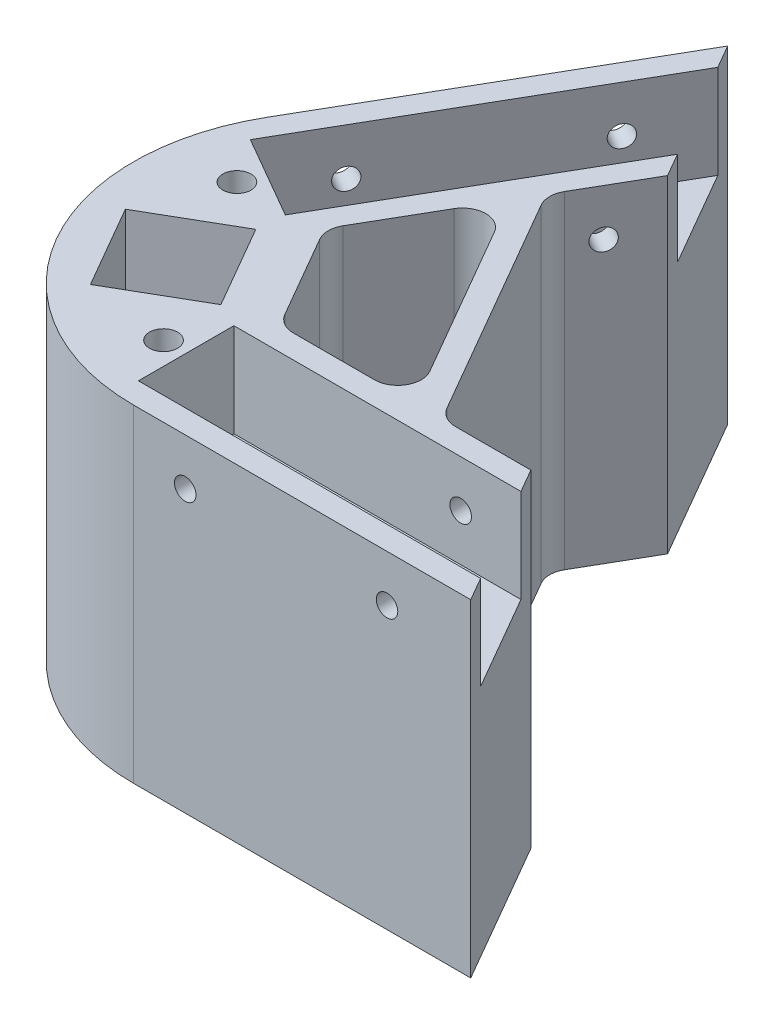
from build123d import *

# Parameters (mm, degrees)
BOSS_EXTRUDE1_DEPTH      = 70
CUT_EXTRUDE2_DEPTH       = 211.416254125
CUT_EXTRUDE2_DEPTH_BACK  = 211.416254125
SKETCH2_W                = 100.4
SKETCH2_H                = 20.4
CUT_EXTRUDE3_DEPTH       = 20
FILLET1_R                = 45
CUT_EXTRUDE4_DEPTH       = 211.416254125
CUT_EXTRUDE4_DEPTH_BACK  = 211.416254125
BOSS_EXTRUDE2_DEPTH      = 70
SKETCH33_R               = 2.3
CUT_EXTRUDE9_DEPTH       = 10
SKETCH34_R               = 2.3
CUT_EXTRUDE10_DEPTH      = 10
FILLET2_R                = 5
CUT_EXTRUDE6_DEPTH       = 5
FILLET3_START            = 72
FILLET3_DEPTH            = 42
FILLET3_START_2          = 73.456949031
FILLET3_2_DEPTH          = 10
FILLET3_START_3          = 108.456949031
FILLET3_3_DEPTH          = 5
SKETCH31_R               = 2.3
CUT_EXTRUDE7_DEPTH       = 10
SKETCH32_R               = 2.3
CUT_EXTRUDE8_DEPTH       = 10
SKETCH35_R               = 2.3
CUT_EXTRUDE11_DEPTH      = 163.520229183
SKETCH36_R               = 4
CUT_EXTRUDE12_DEPTH      = 167.02180224
CUT_EXTRUDE13_DEPTH      = 211.416254158
CUT_EXTRUDE13_DEPTH_BACK = 211.416254158
SKETCH37_R               = 1.7
SKETCH38_R               = 2.3
CUT_EXTRUDE14_DEPTH      = 205.633819321
SKETCH39_R               = 4
CUT_EXTRUDE15_DEPTH      = 46
SKETCH40_R               = 3
CUT_EXTRUDE16_DEPTH      = 210.119583046


with BuildPart() as part:
    # Sketch1 → Boss-Extrude1 (new body)
    with BuildSketch(Plane(origin=(0, 0, 0), x_dir=(1, 0, 0), z_dir=(0, 1, 0))):
        Polygon((0, 0), (150, 0), (75, 129.903810568), align=None)
    extrude(amount=-BOSS_EXTRUDE1_DEPTH)

    # Sketch4 → Cut-Extrude2 (cut, two sides: drawn at the far end of the back side and taken through both)
    with BuildSketch(Plane(origin=(0, 0, 0), x_dir=(1, 0, 0), z_dir=(0, 1, 0)).offset(-CUT_EXTRUDE2_DEPTH_BACK)):
        Polygon((58.511973189, 45.566570047), (40.845863577, 35.365169595), (51.047264029, 17.699059984), (68.713373641, 27.900460435), align=None)
    extrude(amount=CUT_EXTRUDE2_DEPTH + CUT_EXTRUDE2_DEPTH_BACK, mode=Mode.SUBTRACT)

    # Sketch2 → Cut-Extrude3 (cut)
    with BuildSketch(Plane(origin=(0, 0, 0), x_dir=(1, 0, 0), z_dir=(0, 1, 0))):
        Polygon((109.197045256, 138.33483042), (58.997045256, 51.38587988), (41.330127019, 61.58587988), (91.530127019, 148.53483042), align=None)
        with Locations((124.2, 15.2)):
            Rectangle(SKETCH2_W, SKETCH2_H)
    extrude(amount=-CUT_EXTRUDE3_DEPTH, mode=Mode.SUBTRACT)

    # Fillet1
    fillet1_edges = [part.edges().sort_by_distance(p)[0] for p in [
        (0, -35, 0),
    ]]
    fillet(fillet1_edges, radius=FILLET1_R)

    # Sketch27 → Cut-Extrude4 (cut, two sides: drawn at the far end of the back side and taken through both)
    with BuildSketch(Plane(origin=(0, 0, 0), x_dir=(1, 0, 0), z_dir=(0, 1, 0)).offset(-CUT_EXTRUDE4_DEPTH_BACK)):
        Polygon((238.272822489, 351.900634614), (92.551448183, 99.503810568), (65.734741667, 53.05591239), (78.81753352, 30.4), (132.448551817, 30.4), (423.891300428, 30.4), (928.68494852, 321.842748611), (743.066470581, 643.343383225), align=None)
    extrude(amount=CUT_EXTRUDE4_DEPTH + CUT_EXTRUDE4_DEPTH_BACK, mode=Mode.SUBTRACT)

    # Sketch28 → Boss-Extrude2 (add)
    with BuildSketch(Plane(origin=(0, 0, 0), x_dir=(1, 0, 0), z_dir=(0, 1, 0))):
        Polygon((83.054457118, 83.054539524), (113.460135283, 30.4), (107.686368323, 30.4), (80.167837876, 78.054768335), align=None)
    extrude(amount=-BOSS_EXTRUDE2_DEPTH)

    # Sketch33 → Cut-Extrude9 (cut)
    with BuildSketch(Plane(origin=(26.327172275, 0, 15.2), x_dir=(0.4999999999999997, 0, -0.8660254037844388), z_dir=(0.8660254037844389, 0, 0.49999999999999983))):
        with Locations((122.448551817, -10)):
            Circle(SKETCH33_R)
    extrude(amount=-CUT_EXTRUDE9_DEPTH, mode=Mode.SUBTRACT)

    # Sketch34 → Cut-Extrude10 (cut)
    with BuildSketch(Plane(origin=(0, 0, -30.4), x_dir=(-1, 0, 0), z_dir=(0, 0, -1))):
        with Locations((-122.448551817, -10)):
            Circle(SKETCH34_R)
    extrude(amount=-CUT_EXTRUDE10_DEPTH, mode=Mode.SUBTRACT)

    # Fillet2
    fillet2_edges = [part.edges().sort_by_distance(p)[0] for p in [
        (83.054457118, -35, -83.054539524),
        (80.167837876, -35, -78.054768335),
        (65.734741667, -35, -53.05591239),
        (78.81753352, -35, -30.4),
        (107.686368323, -35, -30.4),
        (113.460135283, -35, -30.4),
    ]]
    fillet(fillet2_edges, radius=FILLET2_R)

    # Sketch30 → Cut-Extrude6 (cut)
    with BuildSketch(Plane.XZ.offset(70)):
        Polygon((62.116998953, -39.323625207), (122.736002524, -74.32843068), (125.736414421, -69.132516088), (65.117410851, -34.127710616), align=None)
    extrude(amount=-CUT_EXTRUDE6_DEPTH, mode=Mode.SUBTRACT)

    # Fillet3: read off the stored shape, not the designer's step
    # Fillet3 outline → Fillet3 (cut)
    with BuildSketch(Plane(origin=(0, 0, 0), x_dir=(0.5000686496051991, 0, 0.8659857652883406), z_dir=(0.8659857652883404, 0, -0.5000686496051993)).offset(FILLET3_START)):
        with BuildLine():
            Line((-2.990935885, 70), (-5.490935885, 70))
            ThreePointArc((-5.490935885, 70), (-3.723168932, 69.267766953), (-2.990935885, 67.5))
            Line((-2.990935885, 67.5), (-2.990935885, 70))
        make_face()
        with BuildLine():
            Line((5.509064115, 70), (3.009064115, 70))
            Line((3.009064115, 70), (3.009064115, 67.5))
            ThreePointArc((3.009064115, 67.5), (3.741297162, 69.267766953), (5.509064115, 70))
        make_face()
    extrude(amount=FILLET3_DEPTH, mode=Mode.SUBTRACT)

    # Fillet3 2 outline → Fillet3 2 (add)
    with BuildSketch(Plane(origin=(0, 0, 0), x_dir=(0.5000686496051991, 0, 0.8659857652883406), z_dir=(0.8659857652883404, 0, -0.5000686496051993)).offset(FILLET3_START_2)):
        with BuildLine():
            ThreePointArc((-0.490935885, 65), (-2.258702838, 65.732233047), (-2.990935885, 67.5))
            Line((-2.990935885, 67.5), (-2.990935885, 65))
            Line((-2.990935885, 65), (-0.490935885, 65))
        make_face()
        with BuildLine():
            ThreePointArc((3.009064115, 67.5), (2.276831068, 65.732233047), (0.509064115, 65))
            Line((0.509064115, 65), (3.009064115, 65))
            Line((3.009064115, 65), (3.009064115, 67.5))
        make_face()
    extrude(amount=FILLET3_2_DEPTH)

    # Fillet3 3 outline → Fillet3 3 (add)
    with BuildSketch(Plane(origin=(0, 0, 0), x_dir=(0.5000686496051991, 0, 0.8659857652883406), z_dir=(0.8659857652883404, 0, -0.5000686496051993)).offset(FILLET3_START_3)):
        with BuildLine():
            ThreePointArc((-0.490935885, 65), (-2.258702838, 65.732233047), (-2.990935885, 67.5))
            Line((-2.990935885, 67.5), (-2.990935885, 65))
            Line((-2.990935885, 65), (-0.490935885, 65))
        make_face()
        with BuildLine():
            ThreePointArc((3.009064115, 67.5), (2.276831068, 65.732233047), (0.509064115, 65))
            Line((0.509064115, 65), (3.009064115, 65))
            Line((3.009064115, 65), (3.009064115, 67.5))
        make_face()
    extrude(amount=FILLET3_3_DEPTH)

    # Sketch31 → Cut-Extrude7 (cut)
    with BuildSketch(Plane(origin=(4.330127019, 0, 2.5), x_dir=(0.5000000000000019, 0, -0.8660254037844376), z_dir=(0.8660254037844376, 0, 0.5000000000000019))):
        with Locations((89, -10)):
            Circle(SKETCH31_R)
        with Locations((132.113248654, -10)):
            Circle(SKETCH31_R)
    extrude(amount=-CUT_EXTRUDE7_DEPTH, mode=Mode.SUBTRACT)

    # Sketch32 → Cut-Extrude8 (cut)
    with BuildSketch(Plane(origin=(0, 0, -5), x_dir=(-1, 0, 0), z_dir=(0, 0, -1))):
        with Locations((-132.113248654, -10)):
            Circle(SKETCH32_R)
        with Locations((-89, -10)):
            Circle(SKETCH32_R)
    extrude(amount=-CUT_EXTRUDE8_DEPTH, mode=Mode.SUBTRACT)

    # Sketch35 → Cut-Extrude11 (cut, through all)
    with BuildSketch(Plane(origin=(45.946562611, 0, -26.532116854), x_dir=(-0.5000686496051995, 0, -0.8659857652883403), z_dir=(0.8659857652883401, 0, -0.5000686496051994))):
        with Locations((0, -15)):
            Circle(SKETCH35_R)
        with Locations((0, -55)):
            Circle(SKETCH35_R)
    extrude(amount=-CUT_EXTRUDE11_DEPTH, mode=Mode.SUBTRACT)

    # Sketch36 → Cut-Extrude12 (cut, through all)
    with BuildSketch(Plane(origin=(42.482619549, 0, -24.531842256), x_dir=(-0.5000686496051995, 0, -0.8659857652883403), z_dir=(0.8659857652883401, 0, -0.5000686496051994))):
        with Locations((0, -15)):
            Circle(SKETCH36_R)
        with Locations((0, -55)):
            Circle(SKETCH36_R)
    extrude(amount=-CUT_EXTRUDE12_DEPTH, mode=Mode.SUBTRACT)

    # Sketch37 → Cut-Extrude13 (cut, two sides: drawn at the far end of the back side and taken through both)
    with BuildSketch(Plane.XZ.offset(70).offset(-CUT_EXTRUDE13_DEPTH_BACK)):
        with Locations(Location((69.166562249, -15.2, 0), (0, 0, 270))):
            Circle(SKETCH37_R)
        with Locations(Location((105.195419079, -15.2, 0), (0, 0, 270))):
            Circle(SKETCH37_R)
        with Locations(Location((47.746867262, -52.3, 0), (0, 0, 270))):
            Circle(SKETCH37_R)
        with Locations(Location((65.761295677, -83.501905284, 0), (0, 0, 270))):
            Circle(SKETCH37_R)
    extrude(amount=CUT_EXTRUDE13_DEPTH + CUT_EXTRUDE13_DEPTH_BACK, mode=Mode.SUBTRACT)

    # Sketch38 → Cut-Extrude14 (cut, through all)
    with BuildSketch(Plane(origin=(0, -20, 0), x_dir=(1, 0, 0), z_dir=(0, 1, 0))):
        with Locations(Location((89, 15.2, 0), (0, 0, 270))):
            Circle(SKETCH38_R)
        with Locations(Location((126.224275908, 15.2, 0), (0, 0, 270))):
            Circle(SKETCH38_R)
        with Locations(Location((76.275724092, 101.713429511, 0), (0, 0, 270))):
            Circle(SKETCH38_R)
        with Locations(Location((57.663586138, 69.476260937, 0), (0, 0, 270))):
            Circle(SKETCH38_R)
    extrude(amount=-CUT_EXTRUDE14_DEPTH, mode=Mode.SUBTRACT)

    # Sketch39 → Cut-Extrude15 (cut)
    with BuildSketch(Plane.XZ.offset(70)):
        with Locations(Location((89, -15.2, 0), (0, 0, 270))):
            Circle(SKETCH39_R)
        with Locations(Location((126.224275908, -15.2, 0), (0, 0, 270))):
            Circle(SKETCH39_R)
        with Locations(Location((57.663586138, -69.476260937, 0), (0, 0, 270))):
            Circle(SKETCH39_R)
        with Locations(Location((76.275724092, -101.713429511, 0), (0, 0, 270))):
            Circle(SKETCH39_R)
    extrude(amount=-CUT_EXTRUDE15_DEPTH, mode=Mode.SUBTRACT)

    # Sketch40 → Cut-Extrude16 (cut, through all)
    with BuildSketch(Plane(origin=(0, -66, 0), x_dir=(-1, 0, 0), z_dir=(0, -1, 0))):
        with Locations(Location((-65.761295677, 83.501905284, 0), (0, 0, 90))):
            Circle(SKETCH40_R)
        with Locations(Location((-47.746867262, 52.3, 0), (0, 0, 90))):
            Circle(SKETCH40_R)
        with Locations(Location((-69.166562249, 15.2, 0), (0, 0, 90))):
            Circle(SKETCH40_R)
        with Locations(Location((-105.195419079, 15.2, 0), (0, 0, 90))):
            Circle(SKETCH40_R)
    extrude(amount=-CUT_EXTRUDE16_DEPTH, mode=Mode.SUBTRACT)


solid = part.part
